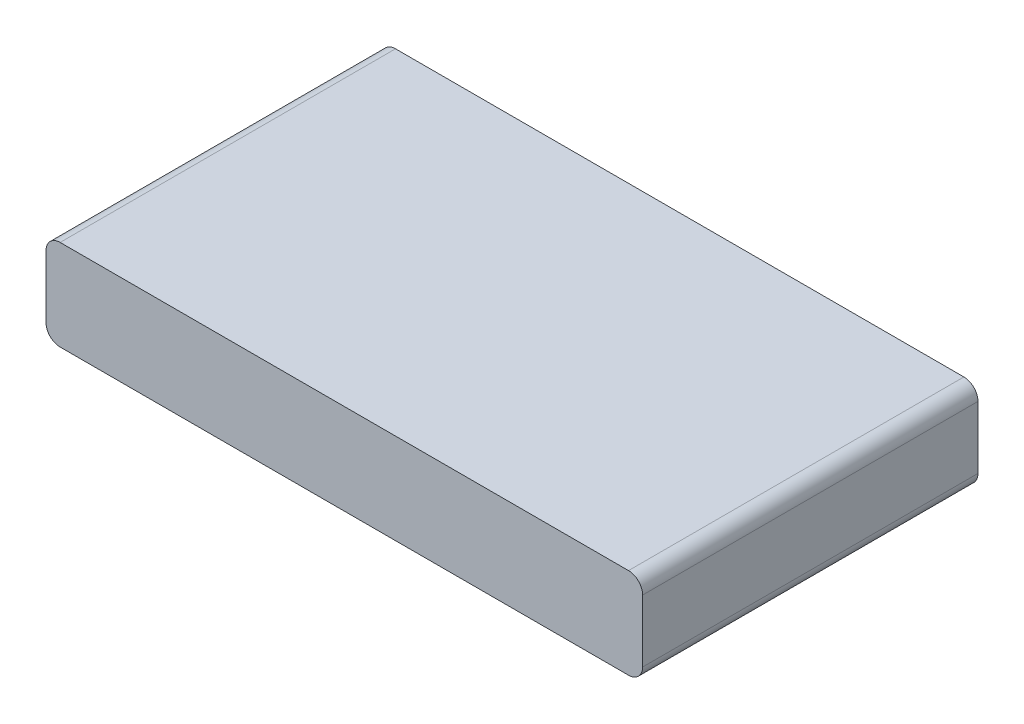
from build123d import *

# Parameters (mm, degrees)
SKETCH1_W           = 126.75
SKETCH1_H           = 71.25
BOSS_EXTRUDE1_DEPTH = 19.25
FILLET2_R           = 3


with BuildPart() as part:
    # Sketch1 → Boss-Extrude1 (new body)
    with BuildSketch(Plane(origin=(0, 0, 0), x_dir=(1, 0, 0), z_dir=(0, 1, 0))):
        with Locations((63.375, 35.625)):
            Rectangle(SKETCH1_W, SKETCH1_H)
    extrude(amount=BOSS_EXTRUDE1_DEPTH)

    # Fillet2
    fillet2_edges = [part.edges().sort_by_distance(p)[0] for p in [
        (126.75, 0, -35.625),
        (126.75, 19.25, -35.625),
        (0, 0, -35.625),
        (0, 19.25, -35.625),
    ]]
    fillet(fillet2_edges, radius=FILLET2_R)


solid = part.part
